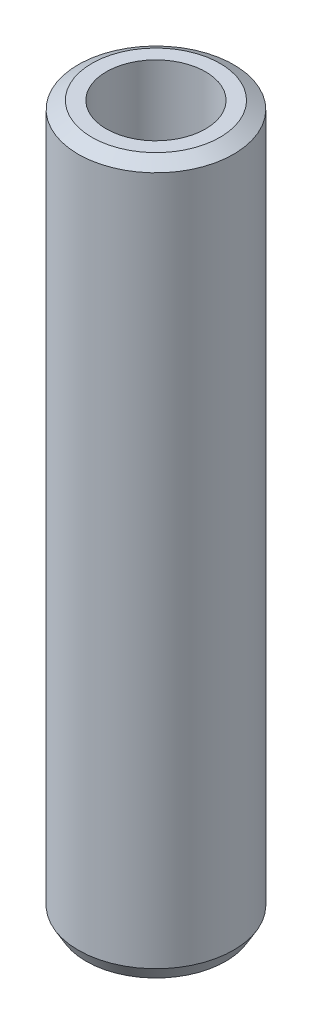
from build123d import *
from OCP.BRepFilletAPI import BRepFilletAPI_MakeChamfer

# Parameters (mm, degrees)
SKETCH1_R           = 52.5
BOSS_EXTRUDE1_DEPTH = 480.348760064
SKETCH2_R           = 33.516671451
CUT_EXTRUDE1_DEPTH  = 487.052909975
CHAMFER1_SIZE       = 5.312065289
CHAMFER1_SIZE2      = 9.200766973


with BuildPart() as part:
    # Sketch1 → Boss-Extrude1 (new body)
    with BuildSketch(Plane(origin=(0, 0, 0), x_dir=(1, 0, 0), z_dir=(0, 1, 0))):
        Circle(SKETCH1_R)
    extrude(amount=BOSS_EXTRUDE1_DEPTH)

    # Sketch2 → Cut-Extrude1 (cut, through all)
    with BuildSketch(Plane(origin=(0, 0, 0), x_dir=(1, 0, 0), z_dir=(0, 1, 0))):
        Circle(SKETCH2_R)
    extrude(amount=CUT_EXTRUDE1_DEPTH, mode=Mode.SUBTRACT)

    # Chamfer1: one chamfer whose edges measure the first distance from different faces: ONE call of the kernel's chamfer builder (chamfer() names one face for all edges)
    chamfer1_edges_1 = [part.edges().sort_by_distance(p)[0] for p in [
        (-52.5, 480.348760064, 0),
    ]]
    chamfer1_side_1 = [part.faces().sort_by_distance(p)[0] for p in [
        (-52.5, 240.174380032, 0),
    ]]
    chamfer1_edges_2 = [part.edges().sort_by_distance(p)[0] for p in [
        (-52.5, 0, 0),
    ]]
    chamfer1_side_2 = [part.faces().sort_by_distance(p)[0] for p in [
        (-51.01507576, 0, 0),
    ]]
    chamfer1 = BRepFilletAPI_MakeChamfer(part.part.solid().wrapped)
    for e in chamfer1_edges_1:
        chamfer1.Add(CHAMFER1_SIZE, CHAMFER1_SIZE2, e.wrapped, chamfer1_side_1[0].wrapped)  # the first distance lies on this face
    for e in chamfer1_edges_2:
        chamfer1.Add(CHAMFER1_SIZE, CHAMFER1_SIZE2, e.wrapped, chamfer1_side_2[0].wrapped)  # the first distance lies on this face
    add(Compound.cast(chamfer1.Shape()), mode=Mode.REPLACE)


solid = part.part
